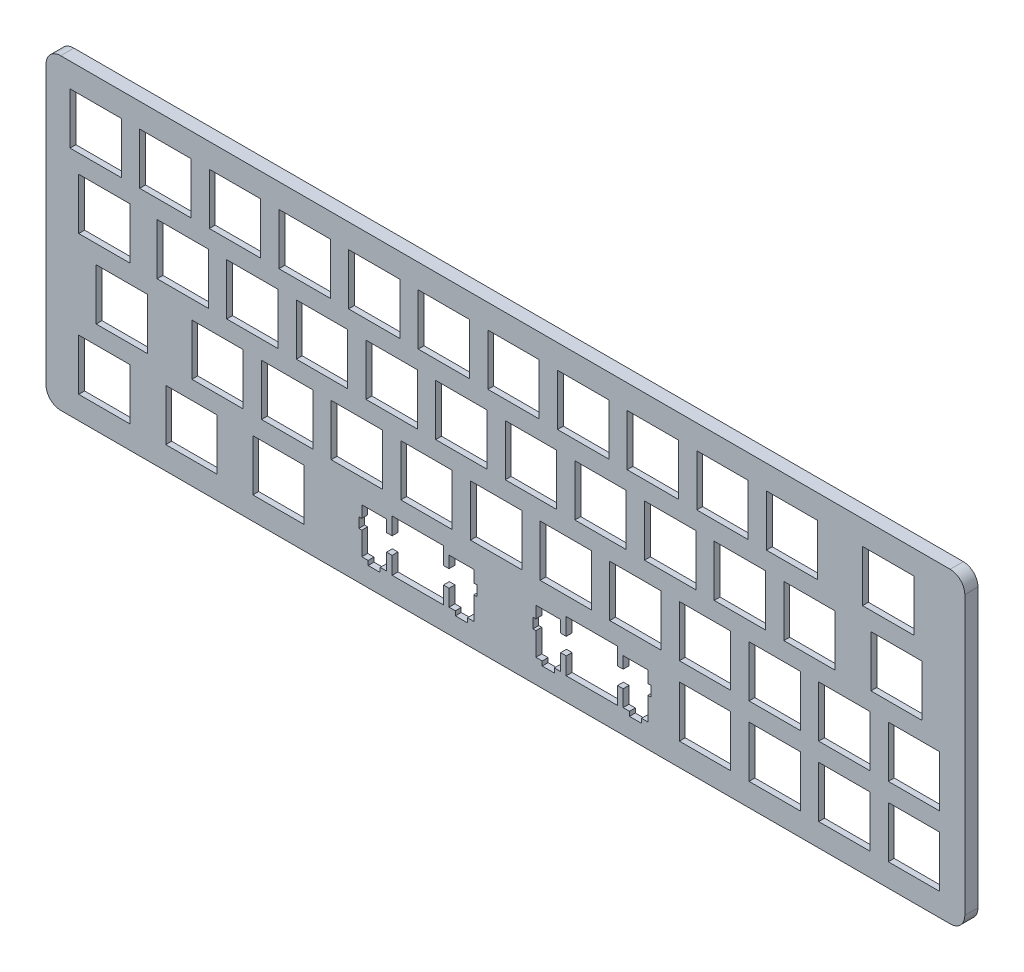
from build123d import *

# Parameters (mm, degrees)
SKETCH3_W           = 14
SKETCH3_H           = 14
BOSS_EXTRUDE1_DEPTH = 1.6
BOSS_EXTRUDE2_DEPTH = 2


with BuildPart() as part:
    # Sketch3 → Boss-Extrude1 (new body)
    with BuildSketch(Plane.XY):
        with BuildLine():
            Line((342.62, -106.45), (99.95, -106.45))
            ThreePointArc((99.95, -106.45), (97.121572875, -107.621572875), (95.95, -110.45))
            Line((95.95, -110.45), (95.95, -186.25))
            ThreePointArc((95.95, -186.25), (97.121572875, -189.078427125), (99.95, -190.25))
            Line((99.95, -190.25), (342.62, -190.25))
            ThreePointArc((342.62, -190.25), (345.448427125, -189.078427125), (346.62, -186.25))
            Line((346.62, -186.25), (346.62, -110.45))
            ThreePointArc((346.62, -110.45), (345.448427125, -107.621572875), (342.62, -106.45))
        make_face()
        with Locations((111.875, -177)):
            Rectangle(SKETCH3_W, SKETCH3_H, mode=Mode.SUBTRACT)
        with Locations((135.625, -177)):
            Rectangle(SKETCH3_W, SKETCH3_H, mode=Mode.SUBTRACT)
        with Locations((159.375, -177)):
            Rectangle(SKETCH3_W, SKETCH3_H, mode=Mode.SUBTRACT)
        Polygon((204.375, -184), (190.375, -184), (190.375, -179.288923941), (188.854357403, -179.288923941), (188.854357403, -183.758923941), (187.129357403, -183.758923941), (187.129357403, -184.958923941), (183.829357403, -184.958923941), (183.829357403, -183.758923941), (182.104357403, -183.758923941), (182.104357403, -177.473923941), (181.279357403, -177.473923941), (181.279357403, -174.688923941), (182.104357403, -174.688923941), (182.104357403, -171.458923941), (188.854357403, -171.458923941), (188.854357403, -174.688923941), (190.375, -174.688923941), (190.375, -170), (190.379357403, -170), (190.379357403, -169.988923941), (204.379357403, -169.988923941), (204.379357403, -174.688923941), (205.904357403, -174.688923941), (205.904357403, -171.458923941), (212.654357403, -171.458923941), (212.654357403, -174.688923941), (213.479357403, -174.688923941), (213.479357403, -177.473923941), (212.654357403, -177.473923941), (212.654357403, -183.758923941), (210.929357403, -183.758923941), (210.929357403, -184.958923941), (207.629357403, -184.958923941), (207.629357403, -183.758923941), (205.904357403, -183.758923941), (205.904357403, -179.288923941), (204.379357403, -179.288923941), (204.379357403, -183.988923941), (204.375, -183.988923941), align=None, mode=Mode.SUBTRACT)
        with Locations((116.625, -158)):
            Rectangle(SKETCH3_W, SKETCH3_H, mode=Mode.SUBTRACT)
        with Locations((142.75, -158)):
            Rectangle(SKETCH3_W, SKETCH3_H, mode=Mode.SUBTRACT)
        with Locations((161.75, -158)):
            Rectangle(SKETCH3_W, SKETCH3_H, mode=Mode.SUBTRACT)
        with Locations((180.75, -158)):
            Rectangle(SKETCH3_W, SKETCH3_H, mode=Mode.SUBTRACT)
        with Locations((199.75, -158)):
            Rectangle(SKETCH3_W, SKETCH3_H, mode=Mode.SUBTRACT)
        with Locations((218.75, -158)):
            Rectangle(SKETCH3_W, SKETCH3_H, mode=Mode.SUBTRACT)
        Polygon((237.875, -170), (237.878267062, -170), (237.878267062, -169.988923941), (251.878267062, -169.988923941), (251.878267062, -174.688923941), (253.403267062, -174.688923941), (253.403267062, -171.458923941), (260.153267062, -171.458923941), (260.153267062, -174.688923941), (260.978267062, -174.688923941), (260.978267062, -177.473923941), (260.153267062, -177.473923941), (260.153267062, -183.758923941), (258.428267062, -183.758923941), (258.428267062, -184.958923941), (255.128267062, -184.958923941), (255.128267062, -183.758923941), (253.403267062, -183.758923941), (253.403267062, -179.288923941), (251.878267062, -179.288923941), (251.878267062, -183.988923941), (251.875, -183.988923941), (251.875, -184), (237.875, -184), (237.875, -179.288923941), (236.353267062, -179.288923941), (236.353267062, -183.758923941), (234.628267062, -183.758923941), (234.628267062, -184.958923941), (231.328267062, -184.958923941), (231.328267062, -183.758923941), (229.603267062, -183.758923941), (229.603267062, -177.473923941), (228.778267062, -177.473923941), (228.778267062, -174.688923941), (229.603267062, -174.688923941), (229.603267062, -171.458923941), (236.353267062, -171.458923941), (236.353267062, -174.688923941), (237.875, -174.688923941), align=None, mode=Mode.SUBTRACT)
        with Locations((275.75, -177)):
            Rectangle(SKETCH3_W, SKETCH3_H, mode=Mode.SUBTRACT)
        with Locations((294.75, -177)):
            Rectangle(SKETCH3_W, SKETCH3_H, mode=Mode.SUBTRACT)
        with Locations((313.75, -177)):
            Rectangle(SKETCH3_W, SKETCH3_H, mode=Mode.SUBTRACT)
        with Locations((332.75, -177)):
            Rectangle(SKETCH3_W, SKETCH3_H, mode=Mode.SUBTRACT)
        with Locations((237.75, -158)):
            Rectangle(SKETCH3_W, SKETCH3_H, mode=Mode.SUBTRACT)
        with Locations((256.75, -158)):
            Rectangle(SKETCH3_W, SKETCH3_H, mode=Mode.SUBTRACT)
        with Locations((275.75, -158)):
            Rectangle(SKETCH3_W, SKETCH3_H, mode=Mode.SUBTRACT)
        with Locations((294.75, -158)):
            Rectangle(SKETCH3_W, SKETCH3_H, mode=Mode.SUBTRACT)
        with Locations((313.75, -158)):
            Rectangle(SKETCH3_W, SKETCH3_H, mode=Mode.SUBTRACT)
        with Locations((332.75, -158)):
            Rectangle(SKETCH3_W, SKETCH3_H, mode=Mode.SUBTRACT)
        with Locations((111.875, -139)):
            Rectangle(SKETCH3_W, SKETCH3_H, mode=Mode.SUBTRACT)
        with Locations((133.25, -139)):
            Rectangle(SKETCH3_W, SKETCH3_H, mode=Mode.SUBTRACT)
        with Locations((152.25, -139)):
            Rectangle(SKETCH3_W, SKETCH3_H, mode=Mode.SUBTRACT)
        with Locations((171.25, -139)):
            Rectangle(SKETCH3_W, SKETCH3_H, mode=Mode.SUBTRACT)
        with Locations((190.25, -139)):
            Rectangle(SKETCH3_W, SKETCH3_H, mode=Mode.SUBTRACT)
        with Locations((209.25, -139)):
            Rectangle(SKETCH3_W, SKETCH3_H, mode=Mode.SUBTRACT)
        with Locations((109.5, -120)):
            Rectangle(SKETCH3_W, SKETCH3_H, mode=Mode.SUBTRACT)
        with Locations((128.5, -120)):
            Rectangle(SKETCH3_W, SKETCH3_H, mode=Mode.SUBTRACT)
        with Locations((147.5, -120)):
            Rectangle(SKETCH3_W, SKETCH3_H, mode=Mode.SUBTRACT)
        with Locations((166.5, -120)):
            Rectangle(SKETCH3_W, SKETCH3_H, mode=Mode.SUBTRACT)
        with Locations((185.5, -120)):
            Rectangle(SKETCH3_W, SKETCH3_H, mode=Mode.SUBTRACT)
        with Locations((204.5, -120)):
            Rectangle(SKETCH3_W, SKETCH3_H, mode=Mode.SUBTRACT)
        with Locations((228.25, -139)):
            Rectangle(SKETCH3_W, SKETCH3_H, mode=Mode.SUBTRACT)
        with Locations((247.25, -139)):
            Rectangle(SKETCH3_W, SKETCH3_H, mode=Mode.SUBTRACT)
        with Locations((266.25, -139)):
            Rectangle(SKETCH3_W, SKETCH3_H, mode=Mode.SUBTRACT)
        with Locations((285.25, -139)):
            Rectangle(SKETCH3_W, SKETCH3_H, mode=Mode.SUBTRACT)
        with Locations((304.25, -139)):
            Rectangle(SKETCH3_W, SKETCH3_H, mode=Mode.SUBTRACT)
        with Locations((328, -139)):
            Rectangle(SKETCH3_W, SKETCH3_H, mode=Mode.SUBTRACT)
        with Locations((223.5, -120)):
            Rectangle(SKETCH3_W, SKETCH3_H, mode=Mode.SUBTRACT)
        with Locations((242.5, -120)):
            Rectangle(SKETCH3_W, SKETCH3_H, mode=Mode.SUBTRACT)
        with Locations((261.5, -120)):
            Rectangle(SKETCH3_W, SKETCH3_H, mode=Mode.SUBTRACT)
        with Locations((280.5, -120)):
            Rectangle(SKETCH3_W, SKETCH3_H, mode=Mode.SUBTRACT)
        with Locations((299.5, -120)):
            Rectangle(SKETCH3_W, SKETCH3_H, mode=Mode.SUBTRACT)
        with Locations((325.72, -120)):
            Rectangle(SKETCH3_W, SKETCH3_H, mode=Mode.SUBTRACT)
    extrude(amount=BOSS_EXTRUDE1_DEPTH)

    # Sketch1 → Boss-Extrude2 (add)
    with BuildSketch(Plane.XY):
        with BuildLine():
            Line((342.620001494, -106.45), (99.949998506, -106.45))
            ThreePointArc((99.949998506, -106.45), (97.121572438, -107.621572438), (95.95, -110.449998506))
            Line((95.95, -110.449998506), (95.95, -186.250001494))
            ThreePointArc((95.95, -186.250001494), (97.121572438, -189.078427562), (99.949998506, -190.25))
            Line((99.949998506, -190.25), (342.620001494, -190.25))
            ThreePointArc((342.620001494, -190.25), (345.448427562, -189.078427562), (346.62, -186.250001494))
            Line((346.62, -186.250001494), (346.62, -110.449998506))
            ThreePointArc((346.62, -110.449998506), (345.448427562, -107.621572438), (342.620001494, -106.45))
        make_face()
        with BuildLine():
            ThreePointArc((97.95, -110.449998506), (98.535786, -109.035786), (99.949998506, -108.45))
            Line((99.949998506, -108.45), (342.620001494, -108.45))
            ThreePointArc((342.620001494, -108.45), (344.034214, -109.035786), (344.62, -110.449998506))
            Line((344.62, -110.449998506), (344.62, -186.250001494))
            ThreePointArc((344.62, -186.250001494), (344.034214, -187.664214), (342.620001494, -188.25))
            Line((342.620001494, -188.25), (99.949998506, -188.25))
            ThreePointArc((99.949998506, -188.25), (98.535786, -187.664214), (97.95, -186.250001494))
            Line((97.95, -186.250001494), (97.95, -110.449998506))
        make_face(mode=Mode.SUBTRACT)
    extrude(amount=-BOSS_EXTRUDE2_DEPTH)


solid = part.part
